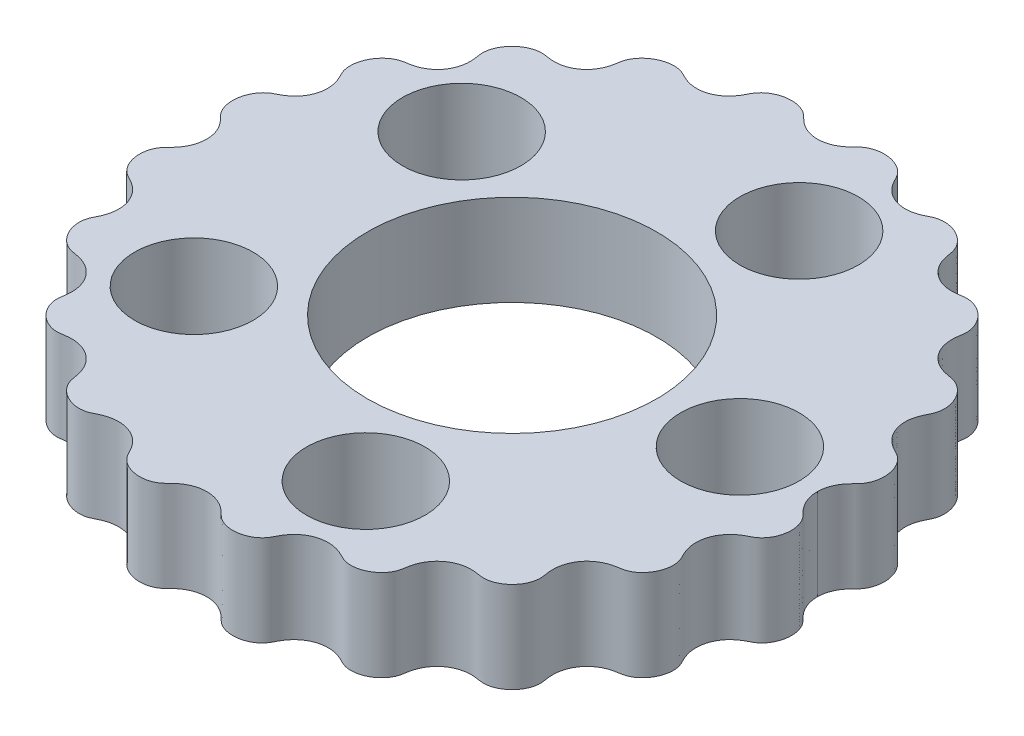
from build123d import *

# Parameters (mm, degrees)
BOSS_EXTRUDE1_START = 1
MAIN_R              = 3.9
MAIN_R_2            = 9.525
BOSS_EXTRUDE1_DEPTH = 6


with BuildPart() as part:
    # MAIN → Boss-Extrude1 (new body)
    with BuildSketch(Plane(origin=(0, 0, 0), x_dir=(1, 0, 0), z_dir=(0, 1, 0)).offset(BOSS_EXTRUDE1_START)):
        with BuildLine():
            add(Edge.make_bspline(
                [(20.1, 0), (20.1, 0.016049475), (20.10042819, 0.048265255), (20.102997256, 0.122217827), (20.111980932, 0.241772144), (20.129908594, 0.365784261), (20.160482731, 0.510263145), (20.200949467, 0.651927408), (20.251052975, 0.790295326), (20.310457626, 0.925031815), (20.405026773, 1.105489785), (20.522557341, 1.284294211), (20.663651728, 1.457905797), (20.825054173, 1.626232115), (20.958535869, 1.756480173), (21.084001151, 1.894913118), (21.19070215, 2.048527229), (21.322181138, 2.295585844), (21.436381782, 2.652555263), (21.480312105, 3.117719001), (21.403906438, 3.600484736), (21.255410516, 3.988503115), (21.088113178, 4.266212931), (20.940586592, 4.45153473), (20.783892784, 4.60313609), (20.624163597, 4.722840948), (20.449787935, 4.819202), (20.27144251, 4.907182077), (20.053826972, 5.02775347), (19.772663447, 5.220092779), (19.460268988, 5.522133789), (19.170367617, 5.979141351), (19.000054809, 6.550986456), (18.996788488, 7.09347867), (19.100354653, 7.522100535), (19.22600522, 7.825047936), (19.323069978, 8.019726709), (19.403208808, 8.17418946), (19.489181816, 8.374410265), (19.566475444, 8.682529861), (19.577864851, 9.101072271), (19.464679992, 9.610899865), (19.231249329, 10.06169528), (18.951631481, 10.396325325), (18.687316384, 10.612198661), (18.478605363, 10.738828373), (18.27672622, 10.826592284), (18.088022057, 10.880549413), (17.894642882, 10.91173651), (17.701344091, 10.941923543), (17.509848243, 10.983109484), (17.321856927, 11.038173185), (17.054914968, 11.140977964), (16.724922472, 11.324678263), (16.36394906, 11.636125273), (16.04411147, 12.112470544), (15.877508027, 12.614075001), (15.840960492, 13.04599222), (15.865791708, 13.378406904), (15.901121962, 13.611045435), (15.931904955, 13.796812252), (15.948155089, 14.03214825), (15.914834064, 14.353727505), (15.78710039, 14.744710058), (15.520698222, 15.177621098), (15.172973033, 15.516306183), (14.815895064, 15.740926601), (14.502994467, 15.864191931), (14.267579789, 15.921315139), (14.048828919, 15.944131552), (13.851076664, 15.938715819), (13.655902731, 15.909039398), (13.461304909, 15.877385295), (13.264984922, 15.856779828), (13.067674425, 15.850574212), (12.776173172, 15.865678978), (12.395590433, 15.940956671), (11.938569212, 16.137109085), (11.470553416, 16.519893429), (11.162879572, 16.97049216), (11.008945031, 17.382763009), (10.941723246, 17.700684498), (10.909391818, 17.910609622), (10.88131532, 18.078311006), (10.825896286, 18.28384026), (10.700795847, 18.566487319), (10.463238575, 18.896536387), (10.10649369, 19.20329467), (9.672270844, 19.42958383), (9.232677179, 19.551096678), (8.86266136, 19.576275628), (8.573868633, 19.540840142), (8.371319786, 19.482977256), (8.233500913, 19.429263516), (8.108846995, 19.36980218), (7.971859121, 19.298414607), (7.817815897, 19.224247184), (7.620319341, 19.142348296), (7.375175899, 19.065537121), (7.059284278, 19.008648031), (6.674311347, 19.005623312), (6.23487299, 19.085333044), (5.767240847, 19.286472452), (5.38043875, 19.585271088), (5.114615337, 19.91251743), (4.953608216, 20.183713005), (4.838337688, 20.408845665), (4.72360429, 20.635366187), (4.500791609, 20.915757491), (4.133761058, 21.194811415), (3.650572556, 21.401524152), (3.141425397, 21.474182478), (2.701085807, 21.439094531), (2.367723237, 21.345707693), (2.140403794, 21.245160735), (1.970791827, 21.139493932), (1.852684175, 21.04557956), (1.760619588, 20.960149721), (1.689220401, 20.8894654), (1.618180579, 20.81844632), (1.5460278, 20.748562596), (1.453458035, 20.663707945), (1.33785031, 20.566946935), (1.195706387, 20.46317673), (0.944410243, 20.311151454), (0.586883972, 20.160779511), (0.097411097, 20.067712928), (-0.506706748, 20.123705295), (-1.010623007, 20.324911261), (-1.364703608, 20.576832472), (-1.593509044, 20.792533664), (-1.731815119, 20.932868041), (-1.846227845, 21.041471908), (-2.001916865, 21.162825929), (-2.254686782, 21.308029569), (-2.62139071, 21.431603659), (-3.111950077, 21.479440319), (-3.664222652, 21.395690883), (-4.133751672, 21.194811679), (-4.50079738, 20.915757334), (-4.723600954, 20.635366277), (-4.838339701, 20.408845611), (-4.95360724, 20.183713031), (-5.114615975, 19.912517413), (-5.380438356, 19.585271099), (-5.767241074, 19.286472446), (-6.23487286, 19.085333048), (-6.674311426, 19.00562331), (-7.059284219, 19.008648033), (-7.37517594, 19.06553712), (-7.620319317, 19.142348297), (-7.817815908, 19.224247184), (-7.971859116, 19.298414607), (-8.108846996, 19.36980218), (-8.233500913, 19.429263515), (-8.371319785, 19.482977259), (-8.573868636, 19.540840136), (-8.862661354, 19.57627564), (-9.232677188, 19.551096661), (-9.672270832, 19.429583855), (-10.106493713, 19.203294623), (-10.463238537, 18.896536464), (-10.7007959, 18.566487209), (-10.825896203, 18.283840429), (-10.881315502, 18.078310633), (-10.909391314, 17.910610649), (-10.941724273, 17.700682406), (-11.008943, 17.382767148), (-11.162882957, 16.970485259), (-11.470548885, 16.519902665), (-11.938575656, 16.137095951), (-12.441451846, 15.92129044), (-12.874268252, 15.849349026), (-13.215931604, 15.851574086), (-13.461292159, 15.877411282), (-13.65590942, 15.909025764), (-13.851073848, 15.938721557), (-14.048830186, 15.944128969), (-14.267579135, 15.921316472), (-14.502994784, 15.864191285), (-14.815894857, 15.740927023), (-15.172973177, 15.516305889), (-15.520698126, 15.177621293), (-15.787100449, 14.744709937), (-15.914834028, 14.353727576), (-15.948155108, 14.032148211), (-15.931904943, 13.796812277), (-15.901121967, 13.611045423), (-15.865791705, 13.37840691), (-15.840960494, 13.045992217), (-15.877508026, 12.614075003), (-16.044111471, 12.112470543), (-16.363949059, 11.636125274), (-16.724922472, 11.324678262), (-17.054914968, 11.140977965), (-17.321856927, 11.038173185), (-17.509848243, 10.983109484), (-17.701344091, 10.941923543), (-17.894642882, 10.911736511), (-18.088022057, 10.880549413), (-18.27672622, 10.826592284), (-18.478605363, 10.738828373), (-18.687316384, 10.612198661), (-18.951631481, 10.396325326), (-19.231249328, 10.06169528), (-19.464679992, 9.610899865), (-19.577864851, 9.101072272), (-19.566475444, 8.682529861), (-19.489181816, 8.374410265), (-19.403208808, 8.17418946), (-19.323069978, 8.01972671), (-19.22600522, 7.825047936), (-19.100354653, 7.522100535), (-18.996788488, 7.093478671), (-19.000054809, 6.550986456), (-19.170367616, 5.979141351), (-19.460268988, 5.52213379), (-19.772663447, 5.220092779), (-20.053826972, 5.027753471), (-20.27144251, 4.907182077), (-20.449787935, 4.819202), (-20.624163597, 4.722840949), (-20.783892784, 4.60313609), (-20.940586592, 4.45153473), (-21.088113178, 4.266212931), (-21.255410516, 3.988503115), (-21.403906438, 3.600484737), (-21.480312105, 3.117719001), (-21.436381782, 2.652555264), (-21.322181138, 2.295585843), (-21.19070215, 2.048527232), (-21.084001151, 1.894913113), (-20.958535869, 1.756480188), (-20.825054173, 1.626232085), (-20.663651728, 1.45790587), (-20.522557341, 1.284294066), (-20.405026773, 1.105490041), (-20.310457626, 0.9250314), (-20.251052975, 0.790296167), (-20.200949467, 0.651926266), (-20.16048273, 0.510264245), (-20.129908594, 0.365772489), (-20.111980932, 0.24187695), (-20.102997255, 0.121794435), (-20.100428187, 0.048465762), (-20.1, 0.016049475), (-20.1, -0.02171016), (-20.100740365, -0.065537224), (-20.104071934, -0.144156063), (-20.112945474, -0.24888272), (-20.129548599, -0.371521199), (-20.158221265, -0.515938032), (-20.204239041, -0.684918351), (-20.273520329, -0.870557648), (-20.358752691, -1.050317426), (-20.458985655, -1.221772432), (-20.566593118, -1.375373307), (-20.677800781, -1.512107496), (-20.78907177, -1.633996227), (-20.89729475, -1.743281226), (-21.006487753, -1.851660443), (-21.108826998, -1.966746908), (-21.220223107, -2.123936398), (-21.346640876, -2.369339666), (-21.448804421, -2.714922855), (-21.479569019, -3.150863822), (-21.406738099, -3.6189376), (-21.253503208, -4.010050586), (-21.054801466, -4.3167693), (-20.834568393, -4.54681101), (-20.612263971, -4.704344178), (-20.325273755, -4.839756744), (-20.00852218, -5.01868956), (-19.684333315, -5.273417476), (-19.386374063, -5.622567486), (-19.165380649, -6.023790243), (-19.031235387, -6.460667693), (-18.988554194, -6.914383703), (-19.031153524, -7.309949886), (-19.121535833, -7.637383735), (-19.231185759, -7.907699698), (-19.340003931, -8.125599511), (-19.458279678, -8.349696035), (-19.534342307, -8.60201151), (-19.571226544, -8.910170929), (-19.547468686, -9.268289446), (-19.441274763, -9.663411072), (-19.230677135, -10.071117867), (-18.962617101, -10.393930449), (-18.69456545, -10.607356203), (-18.463252178, -10.732656246), (-18.290990166, -10.798741664), (-18.148391024, -10.836569426), (-18.003178925, -10.861951575), (-17.857558256, -10.884265091), (-17.641121776, -10.923327988), (-17.357371949, -10.996845119), (-17.017888737, -11.137017594), (-16.649928165, -11.379284126), (-16.334369672, -11.690450594), (-16.08502107, -12.060144405), (-15.913420845, -12.474413535), (-15.837321702, -12.861692439), (-15.826145974, -13.198469455), (-15.849040745, -13.486913028), (-15.886691352, -13.72544992), (-15.927162315, -13.973460833), (-15.917763897, -14.234537693), (-15.855442161, -14.535749675), (-15.720933739, -14.865237104), (-15.494128005, -15.210409224), (-15.157431132, -15.538376323), (-14.781408984, -15.76822783), (-14.431758379, -15.886583939), (-14.146771031, -15.923570894), (-13.940431266, -15.917988379), (-13.777045476, -15.895710114), (-13.573931264, -15.861918407), (-13.311432759, -15.830171544), (-12.987810263, -15.826054921), (-12.60914423, -15.881308187), (-12.229522049, -16.007230154), (-11.876954427, -16.1993096), (-11.563437142, -16.452525279), (-11.299633908, -16.759177641), (-11.094221009, -17.109263485), (-10.975435401, -17.427961134), (-10.912460643, -17.694217159), (-10.877730043, -17.899186149), (-10.856064449, -18.0401656), (-10.822771699, -18.215436473), (-10.756071908, -18.419634752), (-10.618321052, -18.683058453), (-10.378992613, -18.978083153), (-10.050155805, -19.245203321), (-9.632890947, -19.453548744), (-9.223494552, -19.555845862), (-8.883602633, -19.569595951), (-8.624829389, -19.53453372), (-8.448145167, -19.486752645), (-8.311702249, -19.433795975), (-8.180359463, -19.369482763), (-8.050463002, -19.302491925), (-7.848916598, -19.205079035), (-7.567592994, -19.094767002), (-7.195942419, -19.007772682), (-6.736051918, -18.99379513), (-6.286118287, -19.073202806), (-5.86481401, -19.240976426), (-5.488630496, -19.487915279), (-5.210069989, -19.761933205), (-5.011673366, -20.030377918), (-4.88402849, -20.249288085), (-4.804678509, -20.403650404), (-4.722737461, -20.564714017), (-4.627134448, -20.726897435), (-4.486551992, -20.896721045), (-4.26137917, -21.094571853), (-3.962456049, -21.275011587), (-3.592508535, -21.411382192), (-3.15817733, -21.475362584), (-2.768745757, -21.452327592), (-2.437761406, -21.369500955), (-2.168271589, -21.248422688), (-1.958055932, -21.110173628), (-1.785447744, -20.94091701), (-1.622730612, -20.775668556), (-1.414624707, -20.592569598), (-1.152020167, -20.405823234), (-0.814799819, -20.236460165), (-0.395794796, -20.11756634), (0.04306138, -20.082050137), (0.484607542, -20.134421982), (0.91116178, -20.274957645), (1.271012064, -20.478453824), (1.534676394, -20.691199523), (1.722859475, -20.876678362), (1.857461379, -21.012098347), (1.972236287, -21.113107357), (2.128810544, -21.222996315), (2.369691528, -21.346150999), (2.705938739, -21.446074355), (3.128997453, -21.478869711), (3.583297763, -21.414776575), (3.962473712, -21.275005607), (4.261368893, -21.094575333), (4.486558386, -20.89671888), (4.627130565, -20.726898749), (4.722739327, -20.564713386), (4.804677846, -20.403650629), (4.884028711, -20.249288011), (5.011673252, -20.030377957), (5.210070055, -19.761933183), (5.488630456, -19.487915292), (5.864814032, -19.240976419), (6.286118273, -19.073202811), (6.736051926, -18.993795127), (7.195942412, -19.007772684), (7.567592997, -19.094767), (7.848916597, -19.205079036), (8.050463002, -19.302491925), (8.180359447, -19.369482757), (8.311702337, -19.433796008), (8.448144957, -19.486752569), (8.624829844, -19.534533887), (8.883601698, -19.569595609), (9.22349619, -19.555846462), (9.632888472, -19.453547838), (10.050159599, -19.245204711), (10.378986666, -18.978080976), (10.61833073, -18.683061996), (10.756055979, -18.419628921), (10.822802865, -18.215447882), (10.862648263, -18.005084067), (10.897177746, -17.764021208), (10.9630027, -17.461561655), (11.094176446, -17.109247173), (11.299658013, -16.759186465), (11.563423205, -16.452520178), (11.876963914, -16.199313073), (12.229515738, -16.007227845), (12.609148784, -15.881309854), (12.987807102, -15.826053764), (13.311434593, -15.830172215), (13.57393037, -15.861918081), (13.777045847, -15.895710251), (13.940431152, -15.917988338), (14.14677108, -15.923570912), (14.431758349, -15.886583928), (14.781409003, -15.768227837), (15.15743112, -15.53837632), (15.494128012, -15.210409227), (15.720933734, -14.865237102), (15.855442163, -14.535749676), (15.917763895, -14.234537693), (15.927162316, -13.973460834), (15.886691351, -13.72544992), (15.849040745, -13.486913028), (15.826145973, -13.198469455), (15.837321702, -12.861692439), (15.913420844, -12.474413536), (16.085021069, -12.060144406), (16.334369672, -11.690450595), (16.649928164, -11.379284126), (17.017888736, -11.137017594), (17.357371949, -10.99684512), (17.641121776, -10.923327988), (17.857558256, -10.884265091), (18.003178929, -10.86195157), (18.148391004, -10.836569454), (18.290990211, -10.798741599), (18.463252081, -10.732656387), (18.694565648, -10.607355915), (18.96261675, -10.393930958), (19.23067766, -10.071117106), (19.441273966, -9.663412226), (19.54746991, -9.268287674), (19.571224635, -8.910173694), (19.534345549, -8.602006815), (19.458272769, -8.34970604), (19.340018236, -8.125578794), (19.231160509, -7.907736265), (19.14282673, -7.689724945), (19.076304167, -7.473725478), (19.019020301, -7.196875925), (18.993846489, -6.857849588), (19.031255544, -6.460638503), (19.165368749, -6.023807477), (19.386381461, -5.622556771), (19.684328371, -5.273424636), (20.008525148, -5.018685262), (20.325272171, -4.839759039), (20.612264677, -4.704343157), (20.834568029, -4.546811538), (21.054801685, -4.316768984), (21.253503069, -4.010050789), (21.40673819, -3.618937469), (21.479568958, -3.150863911), (21.448804463, -2.714922796), (21.346640853, -2.3693397), (21.220223118, -2.123936381), (21.108826992, -1.966746916), (21.006487755, -1.85166044), (20.897294749, -1.743281222), (20.78907177, -1.633996261), (20.677800781, -1.512107366), (20.566593118, -1.375373687), (20.458985655, -1.221771519), (20.358752691, -1.050319311), (20.273520329, -0.870553985), (20.204239041, -0.684923618), (20.158221265, -0.5159414), (20.129548599, -0.371490762), (20.112945473, -0.248940239), (20.104071929, -0.144509512), (20.100740368, -0.065175164), (20.1, -0.021710161), (20.1, 0)],
                knots=[0.063609002, 0.063609002, 0.063609002, 0.063609002, 0.063609002, 0.064458074, 0.065307146, 0.06700529, 0.068703435, 0.070401579, 0.072099723, 0.073797867, 0.075496012, 0.077194156, 0.081499833, 0.083652672, 0.085805511, 0.087958349, 0.090111188, 0.092264027, 0.094416865, 0.100851345, 0.107285824, 0.113598849, 0.116755361, 0.119911874, 0.122207841, 0.124503809, 0.126799776, 0.129095744, 0.131391711, 0.133687679, 0.138279613, 0.144786754, 0.151293894, 0.158381972, 0.16547005, 0.169487075, 0.171495587, 0.1735041, 0.175512612, 0.177521124, 0.181538149, 0.188088893, 0.194639636, 0.201358698, 0.204718229, 0.20807776, 0.210336636, 0.212595511, 0.214854386, 0.217113262, 0.219372137, 0.221631013, 0.223889888, 0.226148764, 0.232563486, 0.238978207, 0.245649795, 0.252321382, 0.256667064, 0.258839905, 0.261012746, 0.263185587, 0.265358428, 0.269704109, 0.275848778, 0.281993447, 0.288591296, 0.291890221, 0.295189145, 0.297465562, 0.29974198, 0.302018397, 0.304294814, 0.306571231, 0.308847648, 0.311124065, 0.313400483, 0.320031256, 0.32666203, 0.333803829, 0.340945629, 0.344868761, 0.346830327, 0.348791893, 0.350753459, 0.352715025, 0.356638156, 0.362992656, 0.369347155, 0.374206536, 0.379065918, 0.383918614, 0.386344962, 0.387558136, 0.38877131, 0.390744311, 0.392717312, 0.394690313, 0.396663314, 0.400609317, 0.404555319, 0.409450074, 0.414344829, 0.421090178, 0.427835527, 0.431732176, 0.433680501, 0.435628826, 0.439525475, 0.443422124, 0.450061542, 0.456700961, 0.46350218, 0.46690279, 0.4703034, 0.472622355, 0.47494131, 0.476100788, 0.477260265, 0.478419743, 0.479579221, 0.480738698, 0.481898176, 0.484217131, 0.486536087, 0.488855042, 0.495440463, 0.502025885, 0.509259804, 0.516493724, 0.520132717, 0.521952213, 0.523771709, 0.525591206, 0.527410702, 0.531049695, 0.537174367, 0.543299039, 0.549938458, 0.556577876, 0.560474525, 0.564371174, 0.566319499, 0.568267824, 0.572164473, 0.578909822, 0.585655171, 0.590549926, 0.595444681, 0.599390683, 0.603336686, 0.605309687, 0.607282688, 0.609255689, 0.61122869, 0.612441864, 0.613655038, 0.616081386, 0.620934082, 0.625793464, 0.630652845, 0.637007344, 0.643361844, 0.647284975, 0.649246541, 0.651208107, 0.653169673, 0.655131239, 0.659054371, 0.666196171, 0.67333797, 0.679968744, 0.686599517, 0.691152352, 0.693428769, 0.695705186, 0.697981603, 0.70025802, 0.702534438, 0.704810855, 0.708109779, 0.711408704, 0.718006553, 0.724151222, 0.730295891, 0.734641572, 0.736814413, 0.738987254, 0.741160095, 0.743332936, 0.747678618, 0.754350205, 0.761021793, 0.767436514, 0.773851236, 0.776110112, 0.778368987, 0.780627863, 0.782886738, 0.785145614, 0.787404489, 0.789663364, 0.79192224, 0.795281771, 0.798641302, 0.805360364, 0.811911107, 0.818461851, 0.822478876, 0.824487388, 0.8264959, 0.828504413, 0.830512925, 0.83452995, 0.841618028, 0.848706106, 0.855213246, 0.861720387, 0.866312321, 0.868608289, 0.870904256, 0.873200224, 0.875496191, 0.877792159, 0.880088126, 0.883244639, 0.886401151, 0.892714176, 0.899148655, 0.905583135, 0.907735973, 0.909888812, 0.912041651, 0.914194489, 0.916347328, 0.918500167, 0.922805844, 0.924503988, 0.926202133, 0.927900277, 0.929598421, 0.931296565, 0.93299471, 0.934692854, 0.935541926, 0.936390998, 0.936390998, 0.936390998, 0.93753954, 0.938688082, 0.939836624, 0.940985165, 0.943282249, 0.945579333, 0.947876416, 0.9501735, 0.952470583, 0.954767667, 0.956547976, 0.958328284, 0.960108593, 0.961888902, 0.96366921, 0.965449519, 0.969010136, 0.974615965, 0.980221794, 0.985496461, 0.990771127, 0.993903217, 0.997035308, 1.000167399, 1.00329949, 1.008576822, 1.013854154, 1.019131487, 1.024408819, 1.029635531, 1.034862243, 1.040088955, 1.042702312, 1.045315668, 1.048344949, 1.05137423, 1.054403511, 1.057432793, 1.06265791, 1.067883028, 1.073200187, 1.078517346, 1.081927608, 1.083632739, 1.08533787, 1.087043002, 1.088748133, 1.090453264, 1.092158395, 1.097225308, 1.102292221, 1.107359134, 1.112426048, 1.117611695, 1.122797343, 1.127982991, 1.130575815, 1.133168639, 1.136171384, 1.139174129, 1.142176874, 1.145179619, 1.150361937, 1.155544256, 1.161155886, 1.166767516, 1.170581224, 1.172488079, 1.174394933, 1.176301787, 1.178208641, 1.18202235, 1.186627433, 1.191232516, 1.195837599, 1.200442682, 1.205116059, 1.209789435, 1.214462812, 1.219136189, 1.220786941, 1.222437693, 1.224088444, 1.225739196, 1.2290407, 1.232342203, 1.237773978, 1.243205753, 1.24848755, 1.253769348, 1.2571526, 1.258844225, 1.260535851, 1.262227477, 1.263919103, 1.265610729, 1.267302354, 1.272591297, 1.27788024, 1.283169183, 1.288458126, 1.293594209, 1.298730291, 1.303866374, 1.306434415, 1.309002456, 1.310452146, 1.311901836, 1.314801216, 1.317700595, 1.320599975, 1.325733449, 1.330866922, 1.335823509, 1.340780095, 1.343673181, 1.346566267, 1.349459352, 1.352352438, 1.354832904, 1.357313371, 1.362274305, 1.367235238, 1.372196172, 1.377359301, 1.382522431, 1.387685561, 1.39284869, 1.396383657, 1.39815114, 1.399918623, 1.401686106, 1.403453589, 1.406988556, 1.412394883, 1.41780121, 1.422934684, 1.428068158, 1.430967537, 1.433866917, 1.436766297, 1.438215987, 1.439665676, 1.442233718, 1.444801759, 1.449937841, 1.455073924, 1.460210007, 1.465498949, 1.470787892, 1.476076835, 1.481365778, 1.483057404, 1.48474903, 1.486440656, 1.488132281, 1.489823907, 1.491515533, 1.494898785, 1.500180582, 1.50546238, 1.510894155, 1.516325929, 1.519627433, 1.522928937, 1.524579688, 1.52623044, 1.529531944, 1.53420532, 1.538878697, 1.543552074, 1.548225451, 1.552830534, 1.557435617, 1.5620407, 1.566645783, 1.570459491, 1.572366345, 1.5742732, 1.576180054, 1.578086908, 1.581900617, 1.587512247, 1.593123877, 1.598306195, 1.603488514, 1.606491259, 1.609494004, 1.612496749, 1.615499494, 1.618092318, 1.620685142, 1.625870789, 1.631056437, 1.636242085, 1.641308998, 1.646375911, 1.651442825, 1.656509738, 1.658214869, 1.65992, 1.661625131, 1.663330262, 1.665035393, 1.666740524, 1.670150786, 1.675467945, 1.680785105, 1.686010222, 1.69123534, 1.694264621, 1.697293903, 1.700323184, 1.703352465, 1.705965821, 1.708579177, 1.711192533, 1.713805889, 1.719032601, 1.724259314, 1.729536646, 1.734813978, 1.740091311, 1.745368643, 1.748500734, 1.751632824, 1.754764915, 1.757897006, 1.763171672, 1.768446338, 1.774052167, 1.779657997, 1.783218614, 1.784998922, 1.786779231, 1.78855954, 1.790339848, 1.792120157, 1.793900466, 1.796197549, 1.798494633, 1.800791716, 1.8030888, 1.805385884, 1.807682967, 1.808831509, 1.809980051, 1.811128593, 1.812277135, 1.812277135, 1.812277135, 1.812277135, 1.812277135], degree=4))
        make_face()
        with Locations((15, 0)):
            Circle(MAIN_R, mode=Mode.SUBTRACT)
        with Locations((4.635254916, -14.265847744)):
            Circle(MAIN_R, mode=Mode.SUBTRACT)
        with Locations((-12.135254916, -8.816778784)):
            Circle(MAIN_R, mode=Mode.SUBTRACT)
        with Locations((-12.135254916, 8.816778784)):
            Circle(MAIN_R, mode=Mode.SUBTRACT)
        with Locations((4.635254916, 14.265847744)):
            Circle(MAIN_R, mode=Mode.SUBTRACT)
        Circle(MAIN_R_2, mode=Mode.SUBTRACT)
    extrude(amount=BOSS_EXTRUDE1_DEPTH)


solid = part.part
